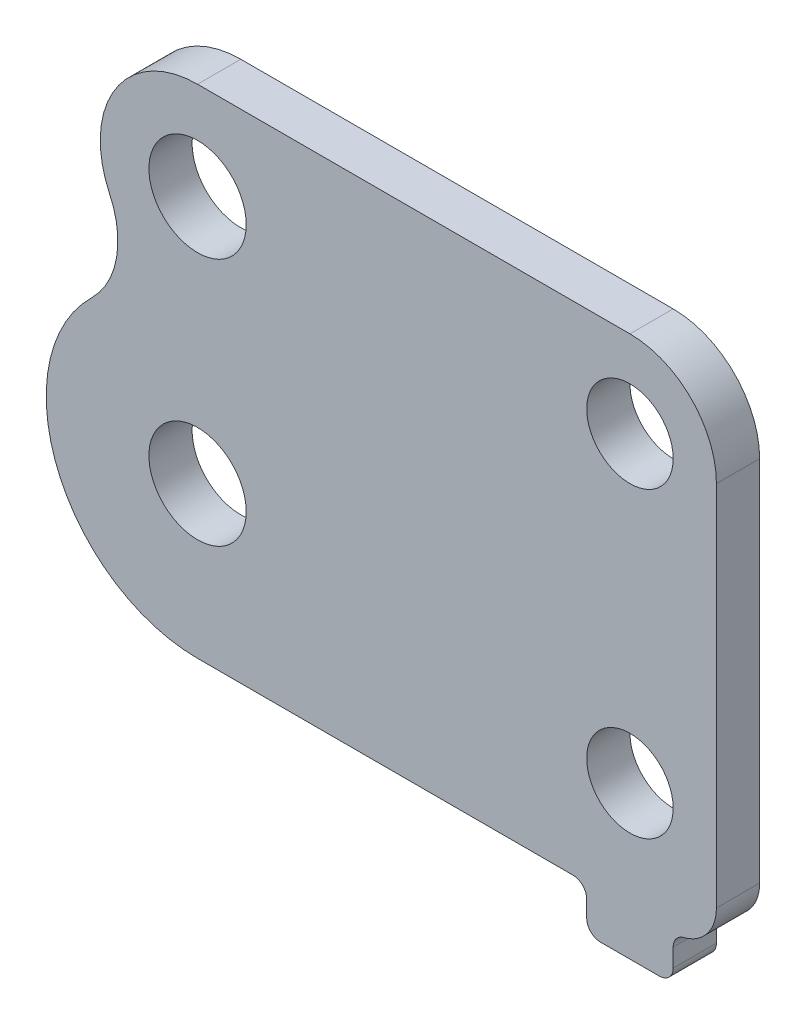
from build123d import *

# Parameters (mm, degrees)
SKETCH2_R           = 1.5875
SKETCH2_R_2         = 1.7859375
BOSS_EXTRUDE1_DEPTH = 1.5875
FILLET1_R           = 3.175
FILLET3_R           = 1.5875
FILLET2_R           = 0.508


with BuildPart() as part:
    # Sketch2 → Boss-Extrude1 (new body)
    with BuildSketch(Plane.XY):
        with BuildLine():
            ThreePointArc((-3.882150485, 3.975024739), (-5.145782024, -2.095910644), (0, -5.55625))
            Line((0, -5.55625), (14.2875, -5.55625))
            Line((14.2875, -5.55625), (14.2875, -7.18185))
            Line((14.2875, -7.18185), (17.4625, -7.18185))
            Line((17.4625, -7.18185), (17.4625, -5.55625))
            Line((17.4625, -5.55625), (19.05, -5.55625))
            Line((19.05, -5.55625), (19.05, 12.7))
            Line((19.05, 12.7), (0, 12.7))
            ThreePointArc((0, 12.7), (-3.017240848, 11.039812391), (-3.229688208, 7.602541474))
            ThreePointArc((-3.229688208, 7.602541474), (-2.975666516, 5.684416094), (-3.882150485, 3.975024739))
        make_face()
        with Locations((15.875, 9.525)):
            Circle(SKETCH2_R, mode=Mode.SUBTRACT)
        with Locations((15.875, -1.5875)):
            Circle(SKETCH2_R, mode=Mode.SUBTRACT)
        Circle(SKETCH2_R_2, mode=Mode.SUBTRACT)
        with Locations((0, 9.128125)):
            Circle(SKETCH2_R_2, mode=Mode.SUBTRACT)
    extrude(amount=BOSS_EXTRUDE1_DEPTH)

    # Fillet1
    fillet1_edges = [part.edges().sort_by_distance(p)[0] for p in [
        (19.05, 12.7, 0.79375),
    ]]
    fillet(fillet1_edges, radius=FILLET1_R)

    # Fillet3
    fillet3_edges = [part.edges().sort_by_distance(p)[0] for p in [
        (19.05, -5.55625, 0.79375),
    ]]
    fillet(fillet3_edges, radius=FILLET3_R - 0.0001)  # a hair under: the kernel refuses the full size

    # Fillet2
    fillet2_edges = [part.edges().sort_by_distance(p)[0] for p in [
        (17.4625, -5.55625, 0.79375),
        (17.4625, -7.18185, 0.79375),
        (14.2875, -7.18185, 0.79375),
        (14.2875, -5.55625, 0.79375),
    ]]
    fillet(fillet2_edges, radius=FILLET2_R)


solid = part.part
